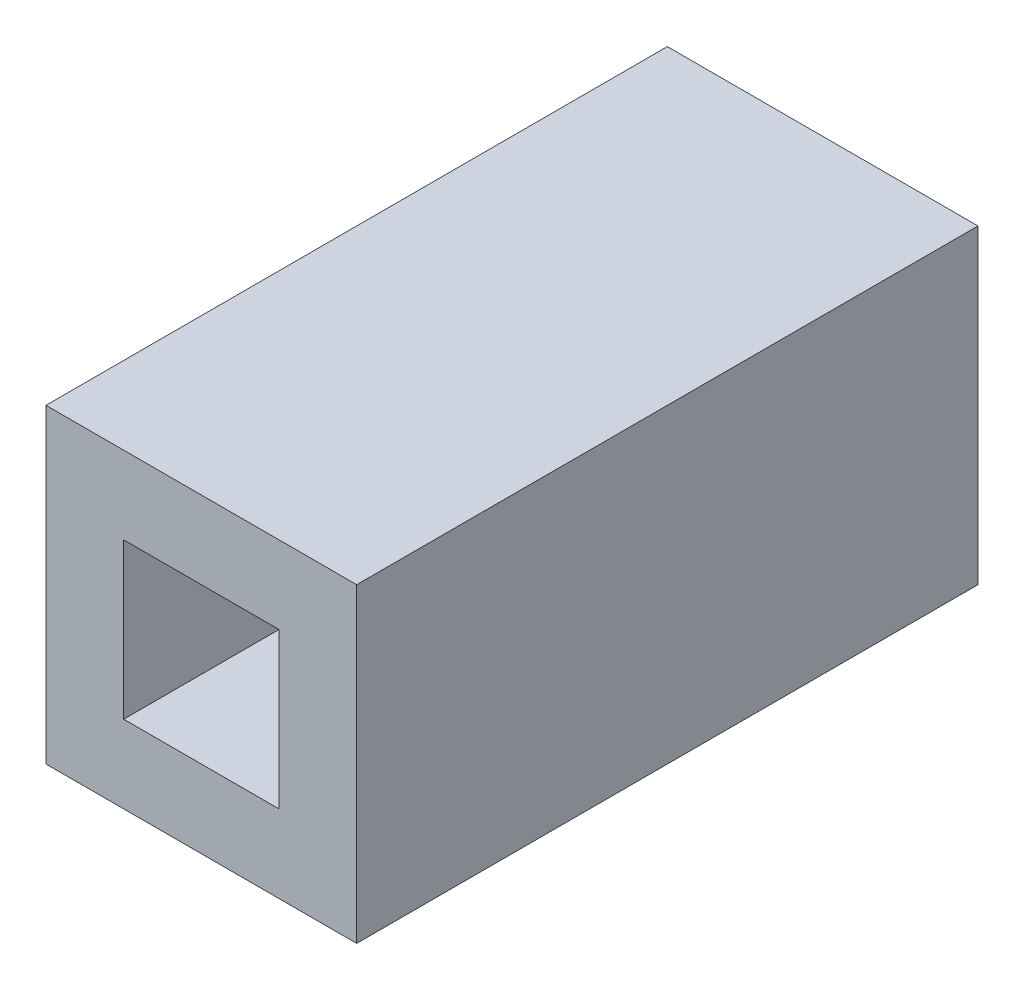
from build123d import *

# Parameters (mm, degrees)
SKETCH1_W           = 25.4
SKETCH1_H           = 25.4
SKETCH1_W_2         = 12.7
SKETCH1_H_2         = 12.7
BOSS_EXTRUDE1_DEPTH = 50.8


with BuildPart() as part:
    # Sketch1 → Boss-Extrude1 (new body)
    with BuildSketch(Plane.XY):
        with Locations((-12.7, 12.7)):
            Rectangle(SKETCH1_W, SKETCH1_H)
        with Locations((-12.7, 12.7)):
            Rectangle(SKETCH1_W_2, SKETCH1_H_2, mode=Mode.SUBTRACT)
    extrude(amount=BOSS_EXTRUDE1_DEPTH)


solid = part.part
